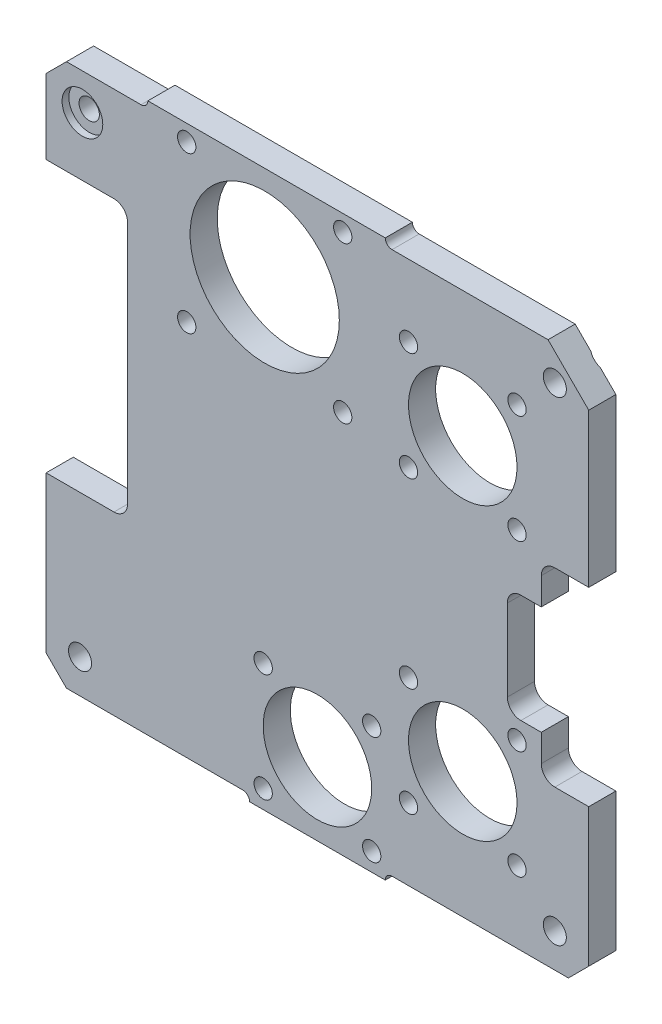
from build123d import *

# Parameters (mm, degrees)
SKETCH_1_R                  = 11
SKETCH_1_R_2                = 8
EXTRUDE_1_DEPTH             = 4
SKETCH_2_R                  = 1.5
CUT_EXTRUDE_1_DEPTH         = 5
HOLE_WIZARD_2_7_2_7_1_D     = 2.7
HOLE_WIZARD_2_7_2_7_1_DEPTH = 8
HOLE_WIZARD_2_7_2_7_1_TIP   = 0.779422863
SKETCH_5_W                  = 35
SKETCH_5_H                  = 4
EXTRUDE_2_DEPTH             = 1
FILLET_1_R                  = 1
SKETCH_6_W                  = 20
SKETCH_6_H                  = 4
EXTRUDE_3_DEPTH             = 1
FILLET_2_R                  = 1
CUT_EXTRUDE_4_DEPTH         = 10
SKETCH_8_R                  = 3
CUT_EXTRUDE_5_DEPTH         = 1
HOLE_WIZARD_M31_D           = 3.4
HOLE_WIZARD_M31_CSINK_D     = 6
HOLE_WIZARD_M31_CSINK_ANGLE = 90


with BuildPart() as part:
    # Эскиз1 → Вытянуть1 (new body)
    with BuildSketch(Plane.XY):
        with BuildLine():
            Line((27.987924211, -32.908691095), (27.987924211, -9.908691095))
            Line((27.987924211, -9.908691095), (21.987924211, -3.908691095))
            Line((21.987924211, -3.908691095), (-49.012075789, -3.908691095))
            Line((-49.012075789, -3.908691095), (-52.012075789, -6.908691095))
            Line((-52.012075789, -6.908691095), (-52.012075789, -32.908691095))
            ThreePointArc((-52.012075789, -32.908691095), (-50.597862227, -33.494477533), (-50.012075789, -34.908691095))
            Line((-50.012075789, -34.908691095), (-50.012075789, -52.908691095))
            ThreePointArc((-50.012075789, -52.908691095), (-50.597862227, -54.322904658), (-52.012075789, -54.908691095))
            Line((-52.012075789, -54.908691095), (-52.012075789, -80.908691095))
            Line((-52.012075789, -80.908691095), (-49.012075789, -83.908691095))
            Line((-49.012075789, -83.908691095), (24.987924211, -83.908691095))
            Line((24.987924211, -83.908691095), (27.987924211, -80.908691095))
            Line((27.987924211, -80.908691095), (27.987924211, -54.908691095))
            ThreePointArc((27.987924211, -54.908691095), (26.573710649, -54.322904658), (25.987924211, -52.908691095))
            Line((25.987924211, -52.908691095), (25.987924211, -34.908691095))
            ThreePointArc((25.987924211, -34.908691095), (26.573710649, -33.494477533), (27.987924211, -32.908691095))
        make_face()
        with Locations((-19.785049223, -16.80111127)):
            Circle(SKETCH_1_R, mode=Mode.SUBTRACT)
        with Locations((9.413259681, -22.483355625)):
            Circle(SKETCH_1_R_2, mode=Mode.SUBTRACT)
        with Locations((-12.012075789, -74.208691095)):
            Circle(SKETCH_1_R_2, mode=Mode.SUBTRACT)
        with Locations((9.413259681, -65.334026565)):
            Circle(SKETCH_1_R_2, mode=Mode.SUBTRACT)
    extrude(amount=EXTRUDE_1_DEPTH)

    # Эскиз2 → Вырез-Вытянуть1 (cut)
    with BuildSketch(Plane.XY.offset(4)):
        with Locations((-46.660308067, -9.260458817)):
            Circle(SKETCH_2_R)
    extrude(amount=-CUT_EXTRUDE_1_DEPTH, mode=Mode.SUBTRACT)

    # Диаметр отверстия Ø2.7 (2.7)1
    with Locations(Plane(origin=(-8.285049223, -5.30111127, 4), x_dir=(1, 0, 0), z_dir=(0, 0, 1))):
        with Locations((0, 0), (0, -23), (-23, -23), (-23, 0), (25.698308904, -9.182244355), (25.698308904, -25.182244355), (9.698308904, -25.182244355), (9.698308904, -9.182244355), (25.698308904, -52.032915295), (25.698308904, -68.032915295), (9.698308904, -68.032915295), (9.698308904, -52.032915295), (4.272973434, -60.907579825), (4.272973434, -76.907579825), (-11.727026566, -60.907579825), (-11.727026566, -76.907579825)):
            Hole(HOLE_WIZARD_2_7_2_7_1_D / 2, depth=HOLE_WIZARD_2_7_2_7_1_DEPTH)
            with Locations((0, 0, -(HOLE_WIZARD_2_7_2_7_1_DEPTH + HOLE_WIZARD_2_7_2_7_1_TIP / 2))):  # 120° drill point
                Cone(0, HOLE_WIZARD_2_7_2_7_1_D / 2, HOLE_WIZARD_2_7_2_7_1_TIP, mode=Mode.SUBTRACT)

    # Эскиз5 → Вытянуть2 (add)
    with BuildSketch(Plane(origin=(0, -3.908691095, 0), x_dir=(1, 0, 0), z_dir=(0, 1, 0))):
        with Locations((-19.512075789, -2)):
            Rectangle(SKETCH_5_W, SKETCH_5_H)
    extrude(amount=EXTRUDE_2_DEPTH)

    # Скругление1
    fillet_1_edges = [part.edges().sort_by_distance(p)[0] for p in [
        (-2.012075789, -3.908691095, 2),
        (-37.012075789, -3.908691095, 2),
    ]]
    fillet(fillet_1_edges, radius=FILLET_1_R - 0.0001)  # a hair under: the kernel refuses the full size

    # Эскиз6 → Вытянуть3 (add)
    with BuildSketch(Plane.XZ.offset(83.908691095)):
        with Locations((-12.012075789, 2)):
            Rectangle(SKETCH_6_W, SKETCH_6_H)
    extrude(amount=EXTRUDE_3_DEPTH)

    # Скругление2
    fillet_2_edges = [part.edges().sort_by_distance(p)[0] for p in [
        (-2.012075789, -83.908691095, 2),
        (-22.012075789, -83.908691095, 2),
    ]]
    fillet(fillet_2_edges, radius=FILLET_2_R - 0.0001)  # a hair under: the kernel refuses the full size

    # Эскиз7 → Вытянуть4 (cut)
    with BuildSketch(Plane(origin=(0, 0, 0), x_dir=(-1, 0, 0), z_dir=(0, 0, -1))):
        with BuildLine():
            Line((52.012075789, -17.908691095), (42.012075789, -17.908691095))
            ThreePointArc((42.012075789, -17.908691095), (40.597862227, -18.494477533), (40.012075789, -19.908691095))
            Line((40.012075789, -19.908691095), (40.012075789, -55.908691095))
            ThreePointArc((40.012075789, -55.908691095), (40.597862227, -57.322904658), (42.012075789, -57.908691095))
            Line((42.012075789, -57.908691095), (52.012075789, -57.908691095))
            Line((52.012075789, -57.908691095), (52.012075789, -17.908691095))
        make_face()
        with BuildLine():
            Line((-20.987924211, -54.534916172), (-20.987924211, -58.534916172))
            ThreePointArc((-20.987924211, -58.534916172), (-21.573710649, -59.949129735), (-22.987924211, -60.534916172))
            Line((-22.987924211, -60.534916172), (-27.987924211, -60.534916172))
            Line((-27.987924211, -60.534916172), (-27.987924211, -32.534916172))
            Line((-27.987924211, -32.534916172), (-22.987924211, -32.534916172))
            ThreePointArc((-22.987924211, -32.534916172), (-21.573710649, -33.12070261), (-20.987924211, -34.534916172))
            Line((-20.987924211, -34.534916172), (-20.987924211, -38.534916172))
            Line((-20.987924211, -38.534916172), (-17.987924211, -38.534916172))
            ThreePointArc((-17.987924211, -38.534916172), (-16.573710649, -39.12070261), (-15.987924211, -40.534916172))
            Line((-15.987924211, -40.534916172), (-15.987924211, -52.534916172))
            ThreePointArc((-15.987924211, -52.534916172), (-16.573710649, -53.949129735), (-17.987924211, -54.534916172))
            Line((-17.987924211, -54.534916172), (-20.987924211, -54.534916172))
        make_face()
    extrude(amount=-CUT_EXTRUDE_4_DEPTH, mode=Mode.SUBTRACT)

    # Эскиз8 → Вытянуть5 (cut)
    with BuildSketch(Plane.XY.offset(4)):
        with Locations((-46.660308067, -9.260458817)):
            Circle(SKETCH_8_R)
    extrude(amount=-CUT_EXTRUDE_5_DEPTH, mode=Mode.SUBTRACT)

    # Зенковка для винта с потайной головкой M31 (through all)
    with Locations(Plane(origin=(22.987924211, -78.908691095, 0), x_dir=(-1, 0, 0), z_dir=(0, 0, -1))):
        with Locations((0, 0), (70, 0), (0, 70)):
            CounterSinkHole(HOLE_WIZARD_M31_D / 2, HOLE_WIZARD_M31_CSINK_D / 2, counter_sink_angle=HOLE_WIZARD_M31_CSINK_ANGLE)


solid = part.part
